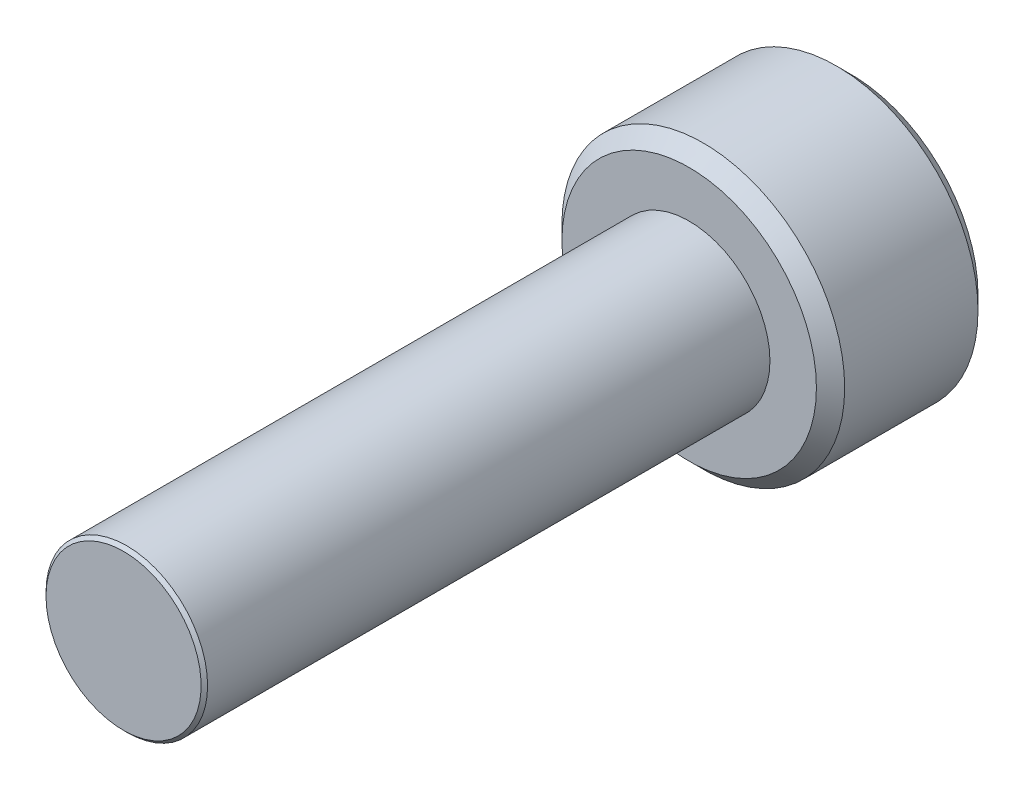
from build123d import *

# Parameters (mm, degrees)
SKETCH1_R            = 2
EXTRUDE1_DEPTH       = 14
CUT_SWEEP1_PITCH     = 0.7
SKETCH6_R            = 3.5
EXTRUDE2_DEPTH       = 4
CUT_EXTRUDE1_DEPTH   = 2.25
CHAMFER1_SIZE        = 0.35
SKETCH10_R           = 2
PARTIAL_THREAD_DEPTH = 14
CHAMFER2_SIZE        = 0.08


with BuildPart() as part:
    # Sketch1 → Extrude1 (new body)
    with BuildSketch(Plane.XY):
        Circle(SKETCH1_R)
    extrude(amount=-EXTRUDE1_DEPTH)

    # Cut-Sweep1: the profile of Sketch3 profile screwed along a right-hand helix of 21 turns, 6 arcs to a turn; built about Z, then put on its axis
    cut_sweep1_z = Axis((0, 0, 0), (0, 0, 1))
    cut_sweep1_corners = [(2.0003, 0, -0.612673205), (1.545336663, 0, -0.35), (1.545336663, 0, -0.2625), (2.0003, 0, 0.000173205)]
    with BuildLine(mode=Mode.PRIVATE) as cut_sweep1_profile:
        Line(cut_sweep1_corners[0], cut_sweep1_corners[1])
        Line(cut_sweep1_corners[1], cut_sweep1_corners[2])
        Line(cut_sweep1_corners[2], cut_sweep1_corners[3])
        Line(cut_sweep1_corners[3], cut_sweep1_corners[0])
    cut_sweep1_cap = Face(cut_sweep1_profile.wire())
    cut_sweep1_turn_angles = [0, 30, 60, 90, 120, 150, 180, 210, 240, 270, 300, 330, 360]
    cut_sweep1_turn_weights = [1, 0.8660254037844387, 1, 0.8660254037844387, 1, 0.8660254037844387, 1, 0.8660254037844387, 1, 0.8660254037844387, 1, 0.8660254037844387, 1]
    cut_sweep1_turn_rails = [Edge.make_bspline([Vector(p[0], p[1], 0).rotate(cut_sweep1_z, cut_sweep1_turn_angles[k]) / cut_sweep1_turn_weights[k] + Vector(0, 0, p[2] + CUT_SWEEP1_PITCH * cut_sweep1_turn_angles[k] / 360) for k in range(13)], [0, 0, 0, 1, 1, 2, 2, 3, 3, 4, 4, 5, 5, 6, 6, 6], 2, cut_sweep1_turn_weights) for p in cut_sweep1_corners]
    cut_sweep1_turn_sides = [Face.make_surface_from_curves(cut_sweep1_turn_rails[p[0]], cut_sweep1_turn_rails[p[1]]) for p in [(0, 1), (1, 2), (2, 3), (3, 0)]]
    cut_sweep1 = Plane(origin=(0, 0, 0), x_dir=(0, 1, 0), z_dir=(0, 0, -1)) * Solid(Shell([*[p.moved(Location((0, 0, CUT_SWEEP1_PITCH * i))) for i in range(21) for p in cut_sweep1_turn_sides], cut_sweep1_cap, cut_sweep1_cap.rotate(cut_sweep1_z, 7560).moved(Location((0, 0, CUT_SWEEP1_PITCH * 7560 / 360)))]))
    add(cut_sweep1, mode=Mode.SUBTRACT)

    # Sketch4 → Cut-Revolve1 (revolve, cut)
    with BuildSketch(Plane(origin=(0, 0, 0), x_dir=(0, 0, -1), z_dir=(1, 0, 0)), mode=Mode.PRIVATE) as cut_revolve1_sk:
        Polygon((0.496211411, 2), (0, 1.291336663), (0, 2), align=None)
    revolve(cut_revolve1_sk.sketch.rotate(Axis((0, 0, 0), (0, 0, -1)), 271.401126896), axis=Axis((0, 0, 0), (0, 0, -1)), mode=Mode.SUBTRACT)

    # Sketch6 → Extrude2 (add)
    with BuildSketch(Plane(origin=(0, 0, -14), x_dir=(-1, 0, 0), z_dir=(0, 0, -1))):
        Circle(SKETCH6_R)
    extrude(amount=EXTRUDE2_DEPTH)

    # Sketch7 → Cut-Extrude1 (cut)
    with BuildSketch(Plane(origin=(0, 0, -18), x_dir=(-1, 0, 0), z_dir=(0, 0, -1))):
        Polygon((0, 1.732050808), (-1.5, 0.866025404), (-1.5, -0.866025404), (0, -1.732050808), (1.5, -0.866025404), (1.5, 0.866025404), align=None)
    extrude(amount=-CUT_EXTRUDE1_DEPTH, mode=Mode.SUBTRACT)

    # Cut-Extrude2 cone 1 section (through the dimple's axis) → Cut-Extrude2 (revolve, cut)
    with BuildSketch(Plane(origin=(0, 0, -18), x_dir=(0, 1, 0), z_dir=(1, 0, 0))):
        Polygon((0, 0), (1.732050808, 0), (0, 1.732050808), align=None)
    revolve(axis=Axis((0, 0, -18), (0, 0, 1)), mode=Mode.SUBTRACT)

    # Chamfer1
    chamfer1_edges = [part.edges().sort_by_distance(p)[0] for p in [
        (3.5, 0, -14),
        (3.5, 0, -18),
    ]]
    chamfer(chamfer1_edges, length=CHAMFER1_SIZE)


with BuildPart() as body_2:
    # Sketch10 → partial thread (new body)
    with BuildSketch(Plane.XY.offset(-14)):
        Circle(SKETCH10_R)
    extrude(amount=PARTIAL_THREAD_DEPTH)

    # Chamfer2
    chamfer2_edges = [body_2.edges().sort_by_distance(p)[0] for p in [
        (-2, 0, 0),
    ]]
    chamfer(chamfer2_edges, length=CHAMFER2_SIZE)


with BuildPart() as part_1:
    add(part.part)

    # Combine1: union body 2
    add(body_2.part)


solid = part_1.part
